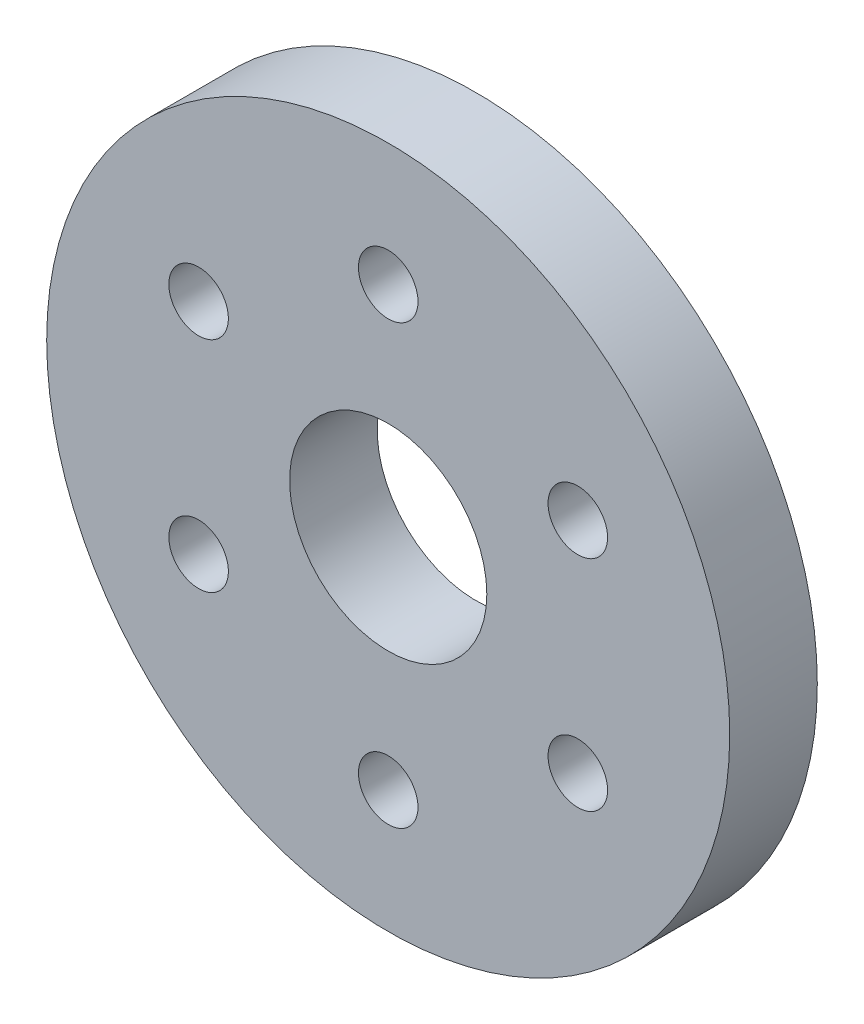
from build123d import *

# Parameters (mm, degrees)
SKETCH1_R           = 24.765
SKETCH1_R_2         = 7.1501
BOSS_EXTRUDE2_DEPTH = 6.35
SKETCH3_R           = 2.159
CUT_EXTRUDE3_DEPTH  = 36.594001601
CIRPATTERN1_COUNT   = 6


with BuildPart() as part:
    # Sketch1 → Boss-Extrude2 (new body)
    with BuildSketch(Plane.XY):
        Circle(SKETCH1_R)
        Circle(SKETCH1_R_2, mode=Mode.SUBTRACT)
    extrude(amount=BOSS_EXTRUDE2_DEPTH)

    # Sketch3 → Cut-Extrude3 (cut, symmetric)
    with BuildSketch(Plane.XY.offset(6.35)):
        with Locations((0, 15.875)):
            Circle(SKETCH3_R)
    cut_extrude3 = extrude(amount=CUT_EXTRUDE3_DEPTH, both=True, mode=Mode.SUBTRACT)

    # CirPattern1: Cut-Extrude3 ×6 about axis
    cirpattern1_axis = Axis((0, 0, 6.35), (0, 0, 1))
    for i in range(1, CIRPATTERN1_COUNT):
        add(cut_extrude3.rotate(cirpattern1_axis, i * 360 / CIRPATTERN1_COUNT), mode=Mode.SUBTRACT)


solid = part.part
